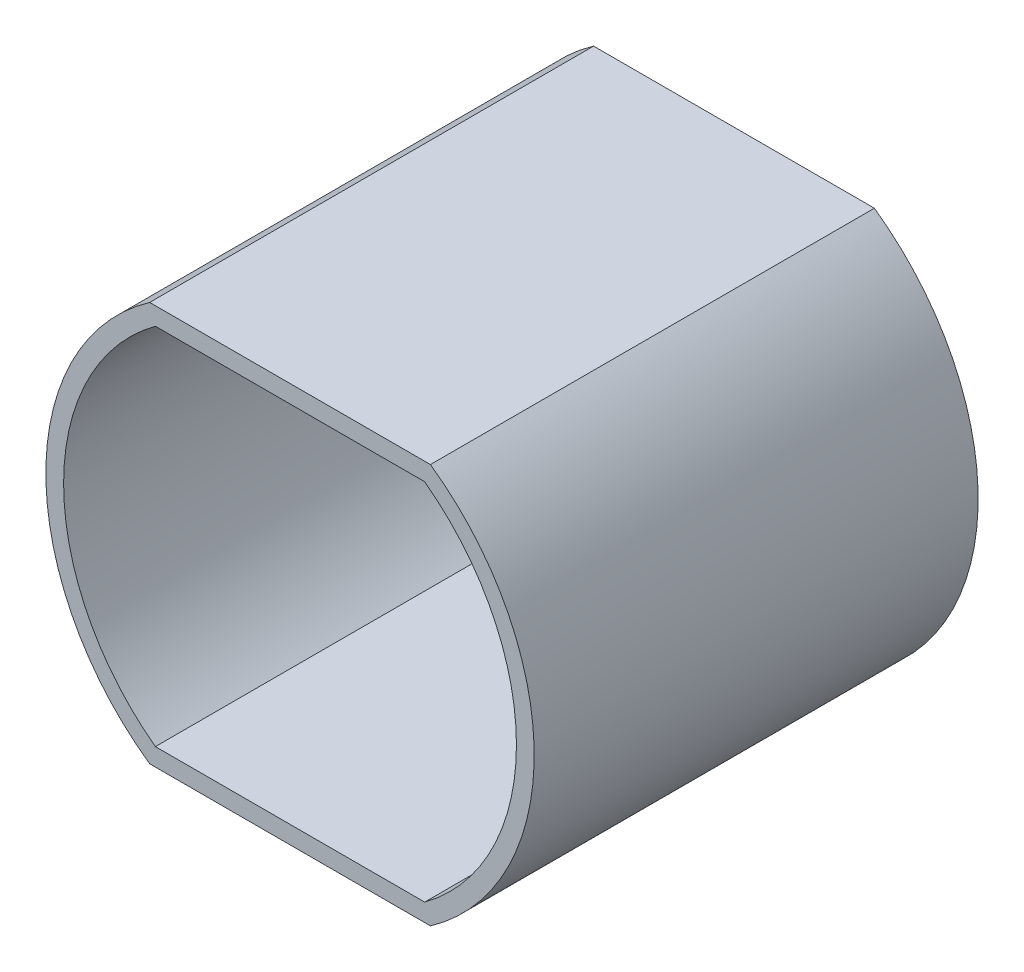
from build123d import *

# Parameters (mm, degrees)
SKETCH2_R           = 2
BOSS_EXTRUDE8_DEPTH = 50
SHELL4_T            = -2


with BuildPart() as part:
    # Sketch2 → Boss-Extrude8 (new body)
    with BuildSketch(Plane.XY):
        with BuildLine():
            Line((15.811388301, 22.5), (-15.811388301, 22.5))
            ThreePointArc((-15.811388301, 22.5), (-27.5, 0), (-15.811388301, -22.5))
            Line((-15.811388301, -22.5), (15.811388301, -22.5))
            ThreePointArc((15.811388301, -22.5), (27.5, 0), (15.811388301, 22.5))
        make_face()
        Circle(SKETCH2_R, mode=Mode.SUBTRACT)
    extrude(amount=BOSS_EXTRUDE8_DEPTH)

    # Shell4
    shell4_openings = [part.faces().sort_by_distance(p)[0] for p in [
        (-2, 0, 25),
        (0, -21.78936648, 50),
    ]]
    offset(amount=SHELL4_T, openings=shell4_openings, kind=Kind.INTERSECTION)


solid = part.part
